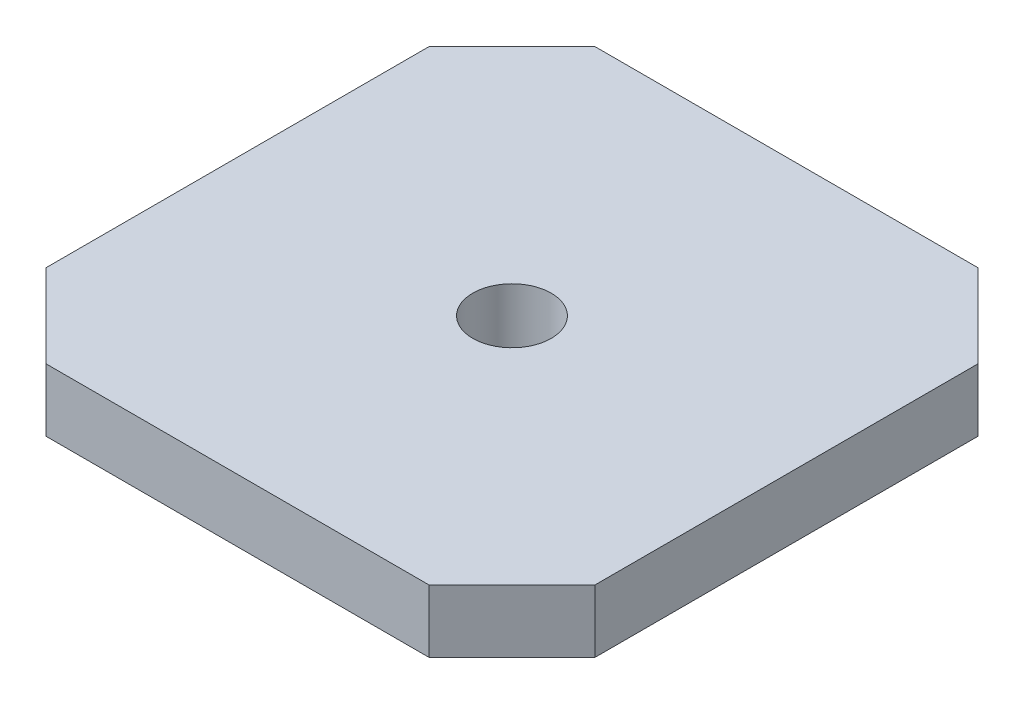
from build123d import *

# Parameters (mm, degrees)
CROQUIS1_W              = 35
CROQUIS1_H              = 35
SALIENTE_EXTRUIR1_DEPTH = 4
CROQUIS2_OUTSIDE_W      = 46.932
CROQUIS2_OUTSIDE_H      = 46.932
CORTAR_EXTRUIR2_DEPTH   = 18
CROQUIS3_R              = 2.5
CORTAR_EXTRUIR3_DEPTH   = 50.658836072


with BuildPart() as part:
    # Croquis1 → Saliente-Extruir1 (new body)
    with BuildSketch(Plane(origin=(0, 0, 0), x_dir=(1, 0, 0), z_dir=(0, 1, 0))):
        with Locations((17.5, 17.5)):
            Rectangle(CROQUIS1_W, CROQUIS1_H)
    extrude(amount=SALIENTE_EXTRUIR1_DEPTH)

    # Croquis2 outside → Cortar-Extruir2 (cut)
    with BuildSketch(Plane(origin=(0, 4, 0), x_dir=(1, 0, 0), z_dir=(0, 1, 0))):
        with Locations((17.5, 17.5)):
            Rectangle(CROQUIS2_OUTSIDE_W, CROQUIS2_OUTSIDE_H)
        Polygon((5.30151519, 35), (0, 29.69848481), (0, 5.30151519), (5.30151519, 0), (29.69848481, 0), (35, 5.30151519), (35, 29.69848481), (29.69848481, 35), align=None, mode=Mode.SUBTRACT)
    extrude(amount=-CORTAR_EXTRUIR2_DEPTH, mode=Mode.SUBTRACT)

    # Croquis3 → Cortar-Extruir3 (cut, through all)
    with BuildSketch(Plane(origin=(0, 4, 0), x_dir=(1, 0, 0), z_dir=(0, 1, 0))):
        with Locations((17.5, 17.5)):
            Circle(CROQUIS3_R)
    extrude(amount=-CORTAR_EXTRUIR3_DEPTH, mode=Mode.SUBTRACT)


solid = part.part
